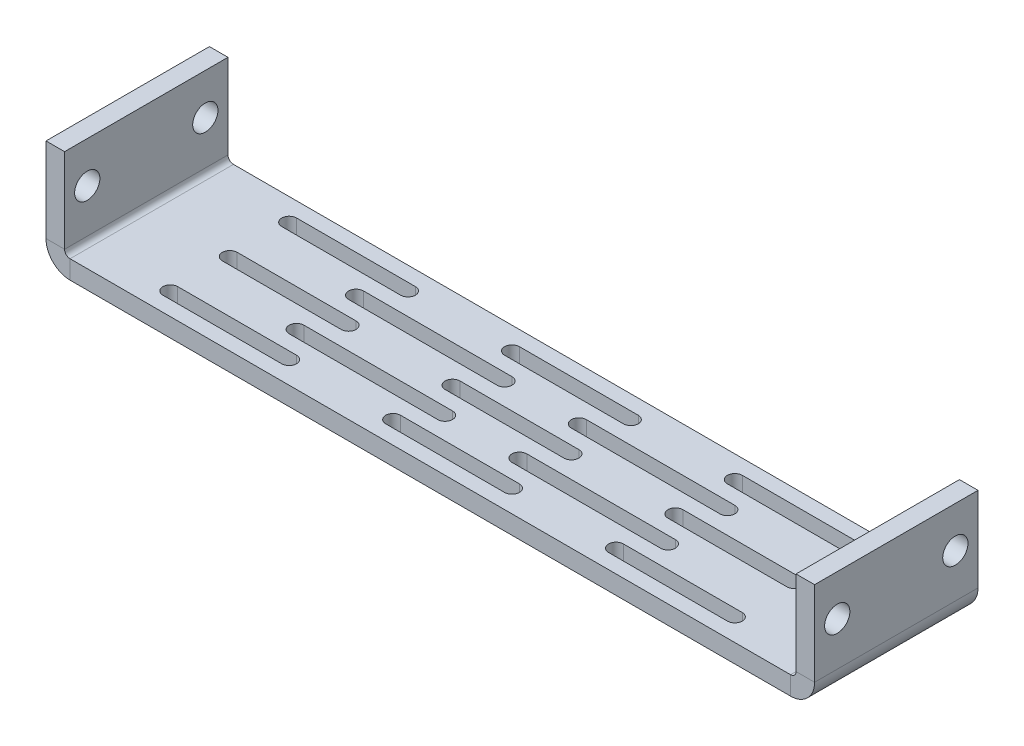
from build123d import *

# Parameters (mm, degrees)
SKETCH_2_W             = 126
SKETCH_2_H             = 22
SKETCH_2_R             = 1.7
SM_BASE_FLANGE_1_DEPTH = 2.5
OTHER_START            = -15.764824005
OTHER_1_DEPTH          = 22
OTHER_START_2          = -11.014823905
OTHER_1_2_DEPTH        = 12.4999998
OTHER_1_3_DEPTH        = 1.3499999
OTHER_START_3          = 4.885176095
OTHER_1_4_DEPTH        = 1.3499999
OTHER_START_4          = -14.414824105
OTHER_1_5_DEPTH        = 19.3000002
OTHER_START_5          = -51.7366
OTHER_1_6_OUTLINE_R    = 1.7
OTHER_1_6_DEPTH        = 103.4732
CUT_EXTRUDE_1_DEPTH    = 57.025302757


with BuildPart() as part:
    # 基体-法兰1: sheet metal written as solids
    # Sketch 2 → 基体-法兰1 (new body)
    with BuildSketch(Plane(origin=(0, 0, 0), x_dir=(1, 0, 0), z_dir=(0, 1, 0))):
        with Locations((0, 4.764824005)):
            Rectangle(SKETCH_2_W, SKETCH_2_H)
        with Locations(Location((57.5, 12.714824005, 0), (0, 0, 270))):
            Circle(SKETCH_2_R, mode=Mode.SUBTRACT)
        with Locations(Location((57.5, -3.185175995, 0), (0, 0, 270))):
            Circle(SKETCH_2_R, mode=Mode.SUBTRACT)
        with Locations(Location((-57.5, -3.185175995, 0), (0, 0, 90))):
            Circle(SKETCH_2_R, mode=Mode.SUBTRACT)
        with Locations(Location((-57.5, 12.714824005, 0), (0, 0, 90))):
            Circle(SKETCH_2_R, mode=Mode.SUBTRACT)
    extrude(amount=-SM_BASE_FLANGE_1_DEPTH)

    # Other 1: read off the stored shape, not the designer's step
    # Other 1 outline → Other 1 (cut)
    with BuildSketch(Plane.XY.offset(OTHER_START)):
        with BuildLine():
            Line((-63, -2.5), (-48.5, -2.5))
            ThreePointArc((-48.5, -2.5), (-50.511404982, -1.799110859), (-51.651666226, 0))
            Line((-51.651666226, 0), (-63, 0))
            Line((-63, 0), (-63, -2.5))
        make_face()
        with BuildLine():
            ThreePointArc((51.651666226, 0), (50.511404982, -1.799110859), (48.5, -2.5))
            Line((48.5, -2.5), (63, -2.5))
            Line((63, -2.5), (63, 0))
            Line((63, 0), (51.651666226, 0))
        make_face()
    extrude(amount=OTHER_1_DEPTH, mode=Mode.SUBTRACT)

    # Other 1 2 outline → Other 1 2 (add)
    with BuildSketch(Plane.XY.offset(OTHER_START_2)):
        with BuildLine():
            ThreePointArc((-51.7366, 0.7366), (-51.715296446, 0.365859759), (-51.651666226, 0))
            Line((-51.651666226, 0), (-48.5, 0))
            ThreePointArc((-48.5, 0), (-49.020854855, 0.215745145), (-49.2366, 0.7366))
            Line((-49.2366, 0.7366), (-49.2366, 12.116056017))
            Line((-49.2366, 12.116056017), (-51.7366, 12.116056017))
            Line((-51.7366, 12.116056017), (-51.7366, 0.7366))
        make_face()
        with BuildLine():
            Line((48.5, 0), (51.651666226, 0))
            ThreePointArc((51.651666226, 0), (51.715296446, 0.365859759), (51.7366, 0.7366))
            Line((51.7366, 0.7366), (51.7366, 12.116056017))
            Line((51.7366, 12.116056017), (49.2366, 12.116056017))
            Line((49.2366, 12.116056017), (49.2366, 0.7366))
            ThreePointArc((49.2366, 0.7366), (49.020854855, 0.215745145), (48.5, 0))
        make_face()
    extrude(amount=OTHER_1_2_DEPTH)

    # Other 1 3 outline → Other 1 3 (add)
    with BuildSketch(Plane.XY.offset(OTHER_START)):
        with BuildLine():
            ThreePointArc((-51.7366, 0.7366), (-51.715296446, 0.365859759), (-51.651666226, 0))
            Line((-51.651666226, 0), (-48.5, 0))
            ThreePointArc((-48.5, 0), (-49.020854855, 0.215745145), (-49.2366, 0.7366))
            Line((-49.2366, 0.7366), (-49.2366, 12.116056017))
            Line((-49.2366, 12.116056017), (-51.7366, 12.116056017))
            Line((-51.7366, 12.116056017), (-51.7366, 0.7366))
        make_face()
        with BuildLine():
            Line((48.5, 0), (51.651666226, 0))
            ThreePointArc((51.651666226, 0), (51.715296446, 0.365859759), (51.7366, 0.7366))
            Line((51.7366, 0.7366), (51.7366, 12.116056017))
            Line((51.7366, 12.116056017), (49.2366, 12.116056017))
            Line((49.2366, 12.116056017), (49.2366, 0.7366))
            ThreePointArc((49.2366, 0.7366), (49.020854855, 0.215745145), (48.5, 0))
        make_face()
    extrude(amount=OTHER_1_3_DEPTH)

    # Other 1 4 outline → Other 1 4 (add)
    with BuildSketch(Plane.XY.offset(OTHER_START_3)):
        with BuildLine():
            ThreePointArc((-51.7366, 0.7366), (-51.715296446, 0.365859759), (-51.651666226, 0))
            Line((-51.651666226, 0), (-48.5, 0))
            ThreePointArc((-48.5, 0), (-49.020854855, 0.215745145), (-49.2366, 0.7366))
            Line((-49.2366, 0.7366), (-49.2366, 12.116056017))
            Line((-49.2366, 12.116056017), (-51.7366, 12.116056017))
            Line((-51.7366, 12.116056017), (-51.7366, 0.7366))
        make_face()
        with BuildLine():
            Line((48.5, 0), (51.651666226, 0))
            ThreePointArc((51.651666226, 0), (51.715296446, 0.365859759), (51.7366, 0.7366))
            Line((51.7366, 0.7366), (51.7366, 12.116056017))
            Line((51.7366, 12.116056017), (49.2366, 12.116056017))
            Line((49.2366, 12.116056017), (49.2366, 0.7366))
            ThreePointArc((49.2366, 0.7366), (49.020854855, 0.215745145), (48.5, 0))
        make_face()
    extrude(amount=OTHER_1_4_DEPTH)

    # Other 1 5 outline → Other 1 5 (add)
    with BuildSketch(Plane.XY.offset(OTHER_START_4)):
        with BuildLine():
            ThreePointArc((49.2366, 0.7366), (49.020854855, 0.215745145), (48.5, 0))
            Line((48.5, 0), (51.651666226, 0))
            ThreePointArc((51.651666226, 0), (51.715296446, 0.365859759), (51.7366, 0.7366))
            Line((51.7366, 0.7366), (51.7366, 12.116056017))
            Line((51.7366, 12.116056017), (49.2366, 12.116056017))
            Line((49.2366, 12.116056017), (49.2366, 0.7366))
        make_face()
        with BuildLine():
            ThreePointArc((-51.7366, 0.7366), (-51.715296446, 0.365859759), (-51.651666226, 0))
            Line((-51.651666226, 0), (-48.5, 0))
            ThreePointArc((-48.5, 0), (-49.020854855, 0.215745145), (-49.2366, 0.7366))
            Line((-49.2366, 0.7366), (-49.2366, 12.116056017))
            Line((-49.2366, 12.116056017), (-51.7366, 12.116056017))
            Line((-51.7366, 12.116056017), (-51.7366, 0.7366))
        make_face()
    extrude(amount=OTHER_1_5_DEPTH)

    # Other 1 6 outline → Other 1 6 (cut)
    with BuildSketch(Plane.YZ.offset(OTHER_START_5)):
        with Locations((6.616056017, -12.714824005)):
            Circle(OTHER_1_6_OUTLINE_R)
        with Locations((6.616056017, 3.185175995)):
            Circle(OTHER_1_6_OUTLINE_R)
    extrude(amount=OTHER_1_6_DEPTH, mode=Mode.SUBTRACT)

    # 草图8 → 切除-拉伸1 (cut, through all)
    with BuildSketch(Plane.XZ.offset(2.5)):
        with BuildLine():
            Line((-8, -3.764824005), (8, -3.764824005))
            ThreePointArc((8, -3.764824005), (9, -4.764824005), (8, -5.764824005))
            Line((8, -5.764824005), (-8, -5.764824005))
            ThreePointArc((-8, -5.764824005), (-9, -4.764824005), (-8, -3.764824005))
        make_face()
        with BuildLine():
            Line((-38, -3.764824005), (-22, -3.764824005))
            ThreePointArc((-22, -3.764824005), (-21, -4.764824005), (-22, -5.764824005))
            Line((-22, -5.764824005), (-38, -5.764824005))
            ThreePointArc((-38, -5.764824005), (-39, -4.764824005), (-38, -3.764824005))
        make_face()
        with BuildLine():
            Line((22, -3.764824005), (38, -3.764824005))
            ThreePointArc((38, -3.764824005), (39, -4.764824005), (38, -5.764824005))
            Line((38, -5.764824005), (22, -5.764824005))
            ThreePointArc((22, -5.764824005), (21, -4.764824005), (22, -3.764824005))
        make_face()
        with BuildLine():
            Line((-8, -11.764824005), (8, -11.764824005))
            ThreePointArc((8, -11.764824005), (9, -12.764824005), (8, -13.764824005))
            Line((8, -13.764824005), (-8, -13.764824005))
            ThreePointArc((-8, -13.764824005), (-9, -12.764824005), (-8, -11.764824005))
        make_face()
        with BuildLine():
            Line((-38, -11.764824005), (-22, -11.764824005))
            ThreePointArc((-22, -11.764824005), (-21, -12.764824005), (-22, -13.764824005))
            Line((-22, -13.764824005), (-38, -13.764824005))
            ThreePointArc((-38, -13.764824005), (-39, -12.764824005), (-38, -11.764824005))
        make_face()
        with BuildLine():
            Line((22, -11.764824005), (38, -11.764824005))
            ThreePointArc((38, -11.764824005), (39, -12.764824005), (38, -13.764824005))
            Line((38, -13.764824005), (22, -13.764824005))
            ThreePointArc((22, -13.764824005), (21, -12.764824005), (22, -11.764824005))
        make_face()
        with BuildLine():
            Line((-8, 4.235175995), (8, 4.235175995))
            ThreePointArc((8, 4.235175995), (9, 3.235175995), (8, 2.235175995))
            Line((8, 2.235175995), (-8, 2.235175995))
            ThreePointArc((-8, 2.235175995), (-9, 3.235175995), (-8, 4.235175995))
        make_face()
        with BuildLine():
            Line((-38, 4.235175995), (-22, 4.235175995))
            ThreePointArc((-22, 4.235175995), (-21, 3.235175995), (-22, 2.235175995))
            Line((-22, 2.235175995), (-38, 2.235175995))
            ThreePointArc((-38, 2.235175995), (-39, 3.235175995), (-38, 4.235175995))
        make_face()
        with BuildLine():
            Line((22, 4.235175995), (38, 4.235175995))
            ThreePointArc((38, 4.235175995), (39, 3.235175995), (38, 2.235175995))
            Line((38, 2.235175995), (22, 2.235175995))
            ThreePointArc((22, 2.235175995), (21, 3.235175995), (22, 4.235175995))
        make_face()
        with BuildLine():
            Line((-25, 0.235175995), (-5, 0.235175995))
            ThreePointArc((-5, 0.235175995), (-4, -0.764824005), (-5, -1.764824005))
            Line((-5, -1.764824005), (-25, -1.764824005))
            ThreePointArc((-25, -1.764824005), (-26, -0.764824005), (-25, 0.235175995))
        make_face()
        with BuildLine():
            Line((5, 0.235175995), (25, 0.235175995))
            ThreePointArc((25, 0.235175995), (26, -0.764824005), (25, -1.764824005))
            Line((25, -1.764824005), (5, -1.764824005))
            ThreePointArc((5, -1.764824005), (4, -0.764824005), (5, 0.235175995))
        make_face()
        with BuildLine():
            Line((-25, -7.764824005), (-5, -7.764824005))
            ThreePointArc((-5, -7.764824005), (-4, -8.764824005), (-5, -9.764824005))
            Line((-5, -9.764824005), (-25, -9.764824005))
            ThreePointArc((-25, -9.764824005), (-26, -8.764824005), (-25, -7.764824005))
        make_face()
        with BuildLine():
            Line((5, -7.764824005), (25, -7.764824005))
            ThreePointArc((25, -7.764824005), (26, -8.764824005), (25, -9.764824005))
            Line((25, -9.764824005), (5, -9.764824005))
            ThreePointArc((5, -9.764824005), (4, -8.764824005), (5, -7.764824005))
        make_face()
    extrude(amount=-CUT_EXTRUDE_1_DEPTH, mode=Mode.SUBTRACT)


solid = part.part
